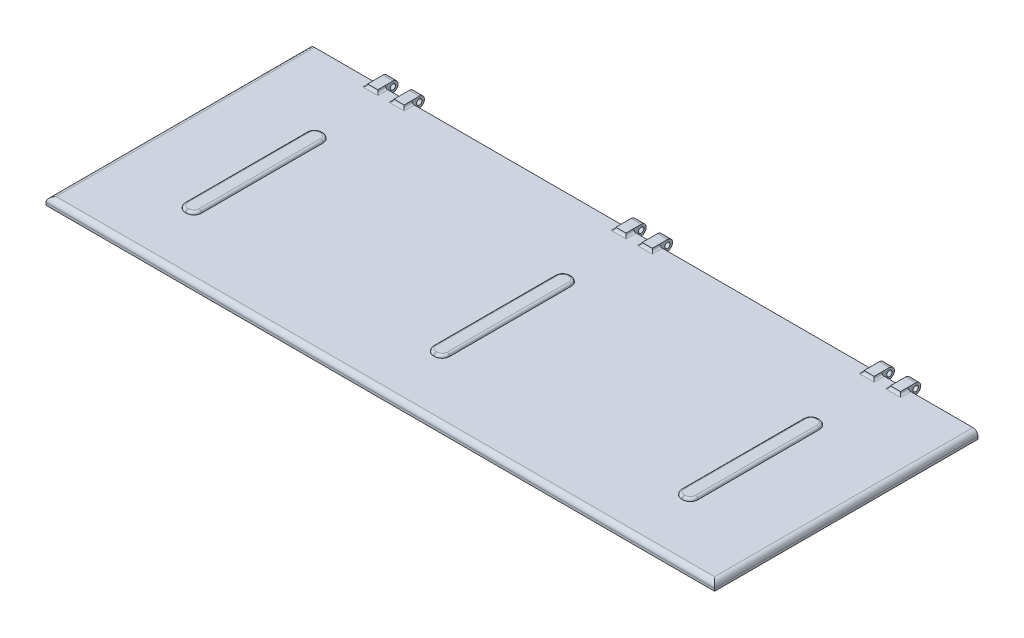
from build123d import *

# Parameters (mm, degrees)
SZKIC1_W                                = 1320
SZKIC1_H                                = 520
DODANIE_WYCI_GNI_CIE1_DEPTH             = 15
SZKIC3_W                                = 20
SZKIC3_H                                = 40
DODANIE_WYCI_GNI_CIE2_DEPTH             = 20
ZAOKR_GLENIE1_RADIUS                    = 10
ZAOKR_GLENIE1_LENGTH                    = 20
ZAOKR_GLENIE2_RADIUS                    = 10
ZAOKR_GLENIE2_LENGTH                    = 20
WYTNIJ_WYCI_GNI_CIE1_REACH              = 1225.816
SZKIC4_R                                = 5.25
ZAOKR_GLENIE5_R                         = 5
ZAOKR_GLENIE9_R                         = 5
WYTNIJ_WYCI_GNI_CIE2_DEPTH              = 5
SZYK_LINIOWY1_COUNT                     = 3
SZYK_LINIOWY1_PITCH                     = 490
ZAOKR_GLENIE1_OF_SZYK_LINIOWY1_2_RADIUS = 10
ZAOKR_GLENIE1_OF_SZYK_LINIOWY1_2_LENGTH = 20
ZAOKR_GLENIE1_OF_SZYK_LINIOWY1_3_RADIUS = 10
ZAOKR_GLENIE1_OF_SZYK_LINIOWY1_3_LENGTH = 20
ZAOKR_GLENIE2_OF_SZYK_LINIOWY1_2_RADIUS = 10
ZAOKR_GLENIE2_OF_SZYK_LINIOWY1_2_LENGTH = 20
ZAOKR_GLENIE2_OF_SZYK_LINIOWY1_3_RADIUS = 10
ZAOKR_GLENIE2_OF_SZYK_LINIOWY1_3_LENGTH = 20
ZAOKR_GLENIE5_OF_SZYK_LINIOWY1_R        = 5
ZAOKR_GLENIE9_OF_SZYK_LINIOWY1_R        = 5
ZAOKR_GLENIE4_R                         = 10
ZAOKR_GLENIE10_R                        = 5


with BuildPart() as part:
    # Szkic1 → Dodanie-wyciągnięcie1 (new body)
    with BuildSketch(Plane(origin=(0, 0, 0), x_dir=(1, 0, 0), z_dir=(0, 1, 0))):
        Rectangle(SZKIC1_W, SZKIC1_H)
    extrude(amount=DODANIE_WYCI_GNI_CIE1_DEPTH)

    # Szkic3 → Dodanie-wyciągnięcie2 (add)
    with BuildSketch(Plane.XZ):
        with Locations((-520, -265)):
            Rectangle(SZKIC3_W, SZKIC3_H)
        with Locations((-468, -265)):
            Rectangle(SZKIC3_W, SZKIC3_H)
        with BuildLine():
            Line((-495, -120), (-493, -120))
            ThreePointArc((-493, -120), (-482.393398282, -115.606601718), (-478, -105))
            Line((-478, -105), (-478, 135))
            ThreePointArc((-478, 135), (-482.393398282, 145.606601718), (-493, 150))
            Line((-493, 150), (-495, 150))
            ThreePointArc((-495, 150), (-505.606601718, 145.606601718), (-510, 135))
            Line((-510, 135), (-510, -105))
            ThreePointArc((-510, -105), (-505.606601718, -115.606601718), (-495, -120))
        make_face()
    dodanie_wyci_gni_cie2 = extrude(amount=-DODANIE_WYCI_GNI_CIE2_DEPTH)

    # Zaokrąglenie1: full round fillet: the end face becomes a half cylinder, R = half its width
    zaokr_glenie1_face = Plane((-468, 10, -285), x_dir=(-1, 0, 0), z_dir=(0, 0, -1))  # on the end face: x along it, z out of the body
    zaokr_glenie1_slab = zaokr_glenie1_face.offset(-ZAOKR_GLENIE1_RADIUS / 2) * Box(ZAOKR_GLENIE1_LENGTH, 2 * ZAOKR_GLENIE1_RADIUS, ZAOKR_GLENIE1_RADIUS, mode=Mode.PRIVATE)  # the body's end, R deep
    zaokr_glenie1_round = Plane((-468, 10, -275), x_dir=(0, 0, -1), z_dir=(-1, 0, 0)) * Cylinder(ZAOKR_GLENIE1_RADIUS, ZAOKR_GLENIE1_LENGTH, mode=Mode.PRIVATE)  # its axis R under the face
    add(zaokr_glenie1_slab - zaokr_glenie1_round, mode=Mode.SUBTRACT)

    # Zaokrąglenie2: full round fillet: the end face becomes a half cylinder, R = half its width
    zaokr_glenie2_face = Plane((-520, 10, -285), x_dir=(-1, 0, 0), z_dir=(0, 0, -1))  # on the end face: x along it, z out of the body
    zaokr_glenie2_slab = zaokr_glenie2_face.offset(-ZAOKR_GLENIE2_RADIUS / 2) * Box(ZAOKR_GLENIE2_LENGTH, 2 * ZAOKR_GLENIE2_RADIUS, ZAOKR_GLENIE2_RADIUS, mode=Mode.PRIVATE)  # the body's end, R deep
    zaokr_glenie2_round = Plane((-520, 10, -275), x_dir=(0, 0, -1), z_dir=(-1, 0, 0)) * Cylinder(ZAOKR_GLENIE2_RADIUS, ZAOKR_GLENIE2_LENGTH, mode=Mode.PRIVATE)  # its axis R under the face
    add(zaokr_glenie2_slab - zaokr_glenie2_round, mode=Mode.SUBTRACT)

    # Wytnij-wyciągnięcie1: up to this face of the body (flat: up to its plane)
    wytnij_wyci_gni_cie1_end = Plane(part.part.faces().sort_by_distance((-458, 11.057172584, -268.852737199))[0])
    # Szkic4 → Wytnij-wyciągnięcie1 (cut, up to the picked face)
    with BuildSketch(Plane.ZY.offset(530), mode=Mode.PRIVATE) as wytnij_wyci_gni_cie1_sk1:
        with Locations((-275, 10)):
            Circle(SZKIC4_R)
    wytnij_wyci_gni_cie1_tool1 = split(extrude(wytnij_wyci_gni_cie1_sk1.sketch, amount=-WYTNIJ_WYCI_GNI_CIE1_REACH, mode=Mode.PRIVATE), bisect_by=wytnij_wyci_gni_cie1_end, keep=Keep.BOTH, mode=Mode.PRIVATE)
    wytnij_wyci_gni_cie1 = wytnij_wyci_gni_cie1_tool1.solids().sort_by(Axis((-530, 10, -275), (1, 0, 0)))[0]
    add(wytnij_wyci_gni_cie1, mode=Mode.SUBTRACT)

    # Zaokrąglenie5
    zaokr_glenie5_edges = [part.edges().sort_by_distance(p)[0] for p in [
        (-458, 15, -252.5),
        (-478, 15, -252.5),
        (-468, 15, -245),
        (-510, 15, -252.5),
        (-520, 15, -245),
        (-530, 15, -252.5),
    ]]
    fillet(zaokr_glenie5_edges, radius=ZAOKR_GLENIE5_R - 0.0001)  # a hair under: the kernel refuses the full size

    # Zaokrąglenie9
    zaokr_glenie9_edges = [part.edges().sort_by_distance(p)[0] for p in [
        (-505.606601718, 20, 145.606601718),
        (-494, 20, 150),
        (-482.393398282, 20, 145.606601718),
        (-478, 20, 15),
        (-482.393398282, 20, -115.606601718),
        (-494, 20, -120),
        (-505.606601718, 20, -115.606601718),
        (-510, 20, 15),
    ]]
    fillet(zaokr_glenie9_edges, radius=ZAOKR_GLENIE9_R - 0.0001)  # a hair under: the kernel refuses the full size

    # Szkic5 → Wytnij-wyciągnięcie2 (cut)
    with BuildSketch(Plane.XZ):
        with BuildLine():
            Line((-495, 145), (-493, 145))
            ThreePointArc((-493, 145), (-485.928932188, 142.071067812), (-483, 135))
            Line((-483, 135), (-483, -105))
            ThreePointArc((-483, -105), (-485.928932188, -112.071067812), (-493, -115))
            Line((-493, -115), (-495, -115))
            ThreePointArc((-495, -115), (-502.071067812, -112.071067812), (-505, -105))
            Line((-505, -105), (-505, 135))
            ThreePointArc((-505, 135), (-502.071067812, 142.071067812), (-495, 145))
        make_face()
    wytnij_wyci_gni_cie2 = extrude(amount=-WYTNIJ_WYCI_GNI_CIE2_DEPTH, mode=Mode.SUBTRACT)

    # Szyk liniowy1: Dodanie-wyciągnięcie2, Wytnij-wyciągnięcie1, Wytnij-wyciągnięcie2 ×3
    with Locations(*[(i * SZYK_LINIOWY1_PITCH, 0, 0) for i in range(1, SZYK_LINIOWY1_COUNT)]):
        add(dodanie_wyci_gni_cie2)
        add(wytnij_wyci_gni_cie1, mode=Mode.SUBTRACT)
        add(wytnij_wyci_gni_cie2, mode=Mode.SUBTRACT)

    # Zaokrąglenie1 of Szyk liniowy1 2: full round fillet: the end face becomes a half cylinder, R = half its width
    zaokr_glenie1_of_szyk_liniowy1_2_face = Plane((22, 10, -285), x_dir=(-1, 0, 0), z_dir=(0, 0, -1))  # on the end face: x along it, z out of the body
    zaokr_glenie1_of_szyk_liniowy1_2_slab = zaokr_glenie1_of_szyk_liniowy1_2_face.offset(-ZAOKR_GLENIE1_OF_SZYK_LINIOWY1_2_RADIUS / 2) * Box(ZAOKR_GLENIE1_OF_SZYK_LINIOWY1_2_LENGTH, 2 * ZAOKR_GLENIE1_OF_SZYK_LINIOWY1_2_RADIUS, ZAOKR_GLENIE1_OF_SZYK_LINIOWY1_2_RADIUS, mode=Mode.PRIVATE)  # the body's end, R deep
    zaokr_glenie1_of_szyk_liniowy1_2_round = Plane((22, 10, -275), x_dir=(0, 0, -1), z_dir=(-1, 0, 0)) * Cylinder(ZAOKR_GLENIE1_OF_SZYK_LINIOWY1_2_RADIUS, ZAOKR_GLENIE1_OF_SZYK_LINIOWY1_2_LENGTH, mode=Mode.PRIVATE)  # its axis R under the face
    add(zaokr_glenie1_of_szyk_liniowy1_2_slab - zaokr_glenie1_of_szyk_liniowy1_2_round, mode=Mode.SUBTRACT)

    # Zaokrąglenie1 of Szyk liniowy1 3: full round fillet: the end face becomes a half cylinder, R = half its width
    zaokr_glenie1_of_szyk_liniowy1_3_face = Plane((512, 10, -285), x_dir=(-1, 0, 0), z_dir=(0, 0, -1))  # on the end face: x along it, z out of the body
    zaokr_glenie1_of_szyk_liniowy1_3_slab = zaokr_glenie1_of_szyk_liniowy1_3_face.offset(-ZAOKR_GLENIE1_OF_SZYK_LINIOWY1_3_RADIUS / 2) * Box(ZAOKR_GLENIE1_OF_SZYK_LINIOWY1_3_LENGTH, 2 * ZAOKR_GLENIE1_OF_SZYK_LINIOWY1_3_RADIUS, ZAOKR_GLENIE1_OF_SZYK_LINIOWY1_3_RADIUS, mode=Mode.PRIVATE)  # the body's end, R deep
    zaokr_glenie1_of_szyk_liniowy1_3_round = Plane((512, 10, -275), x_dir=(0, 0, -1), z_dir=(-1, 0, 0)) * Cylinder(ZAOKR_GLENIE1_OF_SZYK_LINIOWY1_3_RADIUS, ZAOKR_GLENIE1_OF_SZYK_LINIOWY1_3_LENGTH, mode=Mode.PRIVATE)  # its axis R under the face
    add(zaokr_glenie1_of_szyk_liniowy1_3_slab - zaokr_glenie1_of_szyk_liniowy1_3_round, mode=Mode.SUBTRACT)

    # Zaokrąglenie2 of Szyk liniowy1 2: full round fillet: the end face becomes a half cylinder, R = half its width
    zaokr_glenie2_of_szyk_liniowy1_2_face = Plane((-30, 10, -285), x_dir=(-1, 0, 0), z_dir=(0, 0, -1))  # on the end face: x along it, z out of the body
    zaokr_glenie2_of_szyk_liniowy1_2_slab = zaokr_glenie2_of_szyk_liniowy1_2_face.offset(-ZAOKR_GLENIE2_OF_SZYK_LINIOWY1_2_RADIUS / 2) * Box(ZAOKR_GLENIE2_OF_SZYK_LINIOWY1_2_LENGTH, 2 * ZAOKR_GLENIE2_OF_SZYK_LINIOWY1_2_RADIUS, ZAOKR_GLENIE2_OF_SZYK_LINIOWY1_2_RADIUS, mode=Mode.PRIVATE)  # the body's end, R deep
    zaokr_glenie2_of_szyk_liniowy1_2_round = Plane((-30, 10, -275), x_dir=(0, 0, -1), z_dir=(-1, 0, 0)) * Cylinder(ZAOKR_GLENIE2_OF_SZYK_LINIOWY1_2_RADIUS, ZAOKR_GLENIE2_OF_SZYK_LINIOWY1_2_LENGTH, mode=Mode.PRIVATE)  # its axis R under the face
    add(zaokr_glenie2_of_szyk_liniowy1_2_slab - zaokr_glenie2_of_szyk_liniowy1_2_round, mode=Mode.SUBTRACT)

    # Zaokrąglenie2 of Szyk liniowy1 3: full round fillet: the end face becomes a half cylinder, R = half its width
    zaokr_glenie2_of_szyk_liniowy1_3_face = Plane((460, 10, -285), x_dir=(-1, 0, 0), z_dir=(0, 0, -1))  # on the end face: x along it, z out of the body
    zaokr_glenie2_of_szyk_liniowy1_3_slab = zaokr_glenie2_of_szyk_liniowy1_3_face.offset(-ZAOKR_GLENIE2_OF_SZYK_LINIOWY1_3_RADIUS / 2) * Box(ZAOKR_GLENIE2_OF_SZYK_LINIOWY1_3_LENGTH, 2 * ZAOKR_GLENIE2_OF_SZYK_LINIOWY1_3_RADIUS, ZAOKR_GLENIE2_OF_SZYK_LINIOWY1_3_RADIUS, mode=Mode.PRIVATE)  # the body's end, R deep
    zaokr_glenie2_of_szyk_liniowy1_3_round = Plane((460, 10, -275), x_dir=(0, 0, -1), z_dir=(-1, 0, 0)) * Cylinder(ZAOKR_GLENIE2_OF_SZYK_LINIOWY1_3_RADIUS, ZAOKR_GLENIE2_OF_SZYK_LINIOWY1_3_LENGTH, mode=Mode.PRIVATE)  # its axis R under the face
    add(zaokr_glenie2_of_szyk_liniowy1_3_slab - zaokr_glenie2_of_szyk_liniowy1_3_round, mode=Mode.SUBTRACT)

    # Zaokrąglenie5 of Szyk liniowy1
    zaokr_glenie5_of_szyk_liniowy1_edges = [part.edges().sort_by_distance(p)[0] for p in [
        (32, 15, -252.5),
        (12, 15, -252.5),
        (22, 15, -245),
        (-20, 15, -252.5),
        (-30, 15, -245),
        (-40, 15, -252.5),
        (522, 15, -252.5),
        (502, 15, -252.5),
        (512, 15, -245),
        (470, 15, -252.5),
        (460, 15, -245),
        (450, 15, -252.5),
    ]]
    fillet(zaokr_glenie5_of_szyk_liniowy1_edges, radius=ZAOKR_GLENIE5_OF_SZYK_LINIOWY1_R - 0.0001)  # a hair under: the kernel refuses the full size

    # Zaokrąglenie9 of Szyk liniowy1
    zaokr_glenie9_of_szyk_liniowy1_edges = [part.edges().sort_by_distance(p)[0] for p in [
        (-15.606601718, 20, 145.606601718),
        (-4, 20, 150),
        (7.606601718, 20, 145.606601718),
        (12, 20, 15),
        (7.606601718, 20, -115.606601718),
        (-4, 20, -120),
        (-15.606601718, 20, -115.606601718),
        (-20, 20, 15),
        (474.393398282, 20, 145.606601718),
        (486, 20, 150),
        (497.606601718, 20, 145.606601718),
        (502, 20, 15),
        (497.606601718, 20, -115.606601718),
        (486, 20, -120),
        (474.393398282, 20, -115.606601718),
        (470, 20, 15),
    ]]
    fillet(zaokr_glenie9_of_szyk_liniowy1_edges, radius=ZAOKR_GLENIE9_OF_SZYK_LINIOWY1_R - 0.0001)  # a hair under: the kernel refuses the full size

    # Zaokrąglenie4
    zaokr_glenie4_edges = [part.edges().sort_by_distance(p)[0] for p in [
        (660, 15, 0),
        (-660, 15, 0),
        (0, 15, 260),
    ]]
    fillet(zaokr_glenie4_edges, radius=ZAOKR_GLENIE4_R)

    # Zaokrąglenie10
    zaokr_glenie10_edges = [part.edges().sort_by_distance(p)[0] for p in [
        (494.071067812, 5, -112.071067812),
        (486, 5, -115),
        (477.928932188, 5, -112.071067812),
        (475, 5, 15),
        (477.928932188, 5, 142.071067812),
        (486, 5, 145),
        (494.071067812, 5, 142.071067812),
        (4.071067812, 5, -112.071067812),
        (-4, 5, -115),
        (-12.071067812, 5, -112.071067812),
        (-15, 5, 15),
        (-12.071067812, 5, 142.071067812),
        (-4, 5, 145),
        (4.071067812, 5, 142.071067812),
        (-485.928932188, 5, -112.071067812),
        (-494, 5, -115),
        (-502.071067812, 5, -112.071067812),
        (-505, 5, 15),
        (-502.071067812, 5, 142.071067812),
        (-494, 5, 145),
        (-485.928932188, 5, 142.071067812),
        (497, 5, 15),
        (7, 5, 15),
        (-483, 5, 15),
    ]]
    fillet(zaokr_glenie10_edges, radius=ZAOKR_GLENIE10_R - 0.0001)  # a hair under: the kernel refuses the full size


solid = part.part
